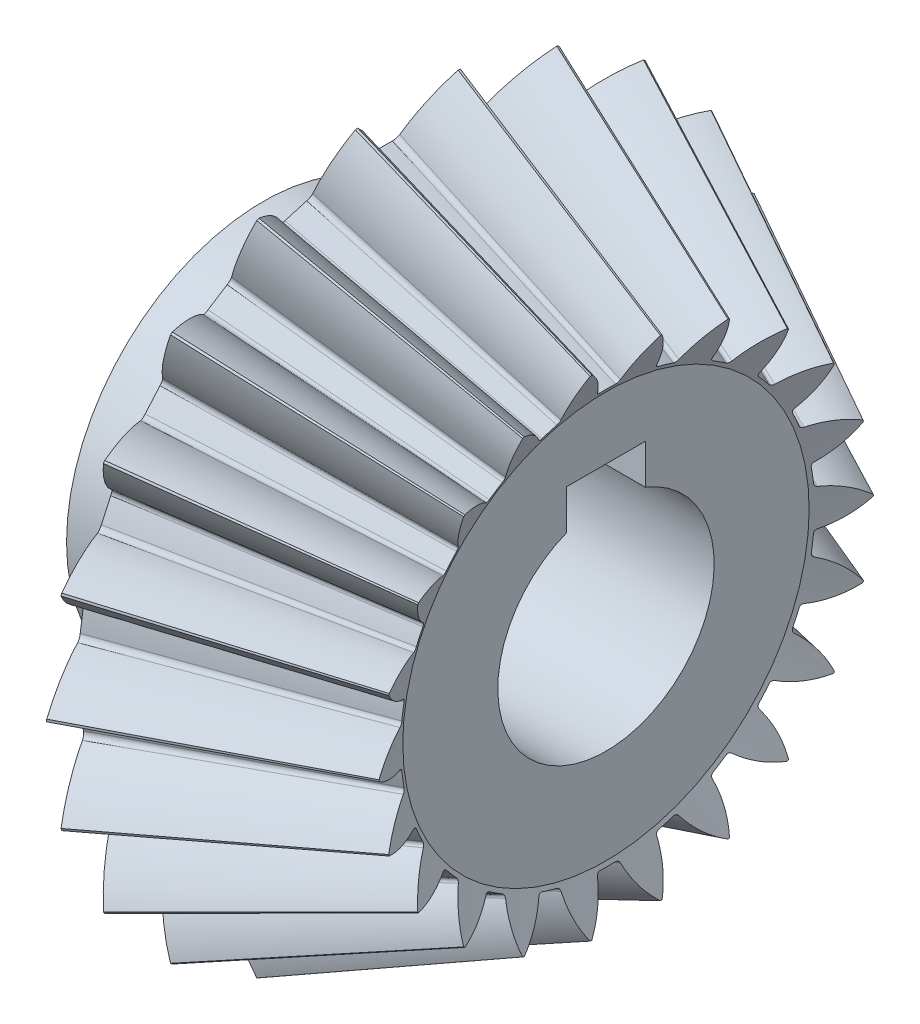
from build123d import *

# Parameters (mm, degrees)
TEETHCUTS_COUNT = 22
TEETHCUTS_ANGLE = 343.636363636
HUBSKE_R        = 20
HUB_DEPTH       = 11.711130341
BORSKE_R        = 11
BORE_DEPTH      = 85.0000508
KEYSKE_W        = 8
KEYSKE_H        = 14.3
KEYWAY_DEPTH    = 85.0000508


with BuildPart() as part:
    # BasProSke → Base-Revolve (revolve)
    with BuildSketch(Plane(origin=(0, 0, 0), x_dir=(1, 0, 0), z_dir=(0, 1, 0)), mode=Mode.PRIVATE) as base_revolve_sk:
        Polygon((0, 0), (0, 30.187699073), (2.993132429, 36.718169819), (25.18183877, 25.128171007), (23.133481134, 20.659027079), (23.133481134, 0), align=None)
    revolve(base_revolve_sk.sketch.rotate(Axis((-10, 0, 0), (1, 0, 0)), 180), axis=Axis((-10, 0, 0), (1, 0, 0)))

    # ToothCut: read off the stored shape, not the designer's step
    # ToothCut: loft between two sections, ruled curve by curve
    toothcut_from = [
        Edge.make_bspline([(73.292168083, 0.006974887, -0.01012031), (73.289773509, 0.001750362, -0.014477462), (73.286789189, -0.004760882, -0.013633686), (73.28488204, -0.008921935, -0.008060281)], [0, 0, 0, 0, 1, 1, 1, 1], 3, [1, 0.813813859, 0.813813859, 1]),
        Edge.make_bspline([(73.28488204, -0.008921935, 0.008060281), (73.286789189, -0.004760882, 0.013633686), (73.289773509, 0.001750362, 0.014477462), (73.292168083, 0.006974887, 0.01012031)], [0, 0, 0, 0, 1, 1, 1, 1], 3, [1, 0.813813859, 0.813813859, 1]),
        Edge.make_bspline([(73.28488204, -0.008921935, -0.008060281), (73.284593319, -0.00955187, -0.007216531), (73.284352068, -0.010078236, -0.00629088), (73.284162271, -0.01049234, -0.005298616)], [0, 0, 0, 0, 1, 1, 1, 1], 3, [1, 0.994494893, 0.994494893, 1]),
        Edge.make_bspline([(73.284162271, -0.01049234, 0.005298616), (73.284352068, -0.010078236, 0.00629088), (73.284593319, -0.00955187, 0.007216531), (73.28488204, -0.008921935, 0.008060281)], [0, 0, 0, 0, 1, 1, 1, 1], 3, [1, 0.994494893, 0.994494893, 1]),
        Edge.make_bspline([(73.284162271, -0.01049234, -0.005298616), (73.28350847, -0.011918814, -0.001880531), (73.28350847, -0.011918814, 0.001880531), (73.284162271, -0.01049234, 0.005298616)], [0, 0, 0, 0, 1, 1, 1, 1], 3, [1, 0.939205559, 0.939205559, 1]),
        Edge.make_line((73.292168083, 0.006974887, 0.01012031), (73.292168083, 0.006974887, -0.01012031)),
    ]
    toothcut_to = [
        Edge.make_bspline([(3.117403564, 36.989306839, -5.776106756), (2.39998287, 35.424025328, -3.800644098), (1.475121547, 33.406146079, -2.407788672), (0.42191645, 31.108244054, -1.716661566)], [0, 0, 0, 0, 1, 1, 1, 1], 3, [1, 0.971492354, 0.971492354, 1]),
        Edge.make_bspline([(0.42191645, 31.108244054, 1.716661566), (1.475121547, 33.406146079, 2.407788672), (2.39998287, 35.424025328, 3.800644098), (3.117403564, 36.989306839, 5.776106756)], [0, 0, 0, 0, 1, 1, 1, 1], 3, [1, 0.971492354, 0.971492354, 1]),
        Edge.make_bspline([(0.42191645, 31.108244054, -1.716661566), (0.311926411, 30.868265787, -1.644484649), (0.244462174, 30.721071088, -1.423851058), (0.248759413, 30.730446882, -1.150372516)], [0, 0, 0, 0, 1, 1, 1, 1], 3, [1, 0.855549764, 0.855549764, 1]),
        Edge.make_bspline([(0.248759413, 30.730446882, 1.150372516), (0.244462174, 30.721071088, 1.423851058), (0.311926411, 30.868265787, 1.644484649), (0.42191645, 31.108244054, 1.716661566)], [0, 0, 0, 0, 1, 1, 1, 1], 3, [1, 0.855549764, 0.855549764, 1]),
        Edge.make_bspline([(0.248759413, 30.730446882, -1.150372516), (0.260807292, 30.756733163, -0.38363919), (0.260807292, 30.756733163, 0.38363919), (0.248759413, 30.730446882, 1.150372516)], [0, 0, 0, 0, 1, 1, 1, 1], 3, [1, 0.999526417, 0.999526417, 1]),
        Edge.make_line((3.117403564, 36.989306839, 5.776106756), (3.117403564, 36.989306839, -5.776106756)),
    ]
    toothcut = Solid(Shell([*[Face.make_surface_from_curves(toothcut_from[k], toothcut_to[k]) for k in range(6)], Face(Wire(toothcut_from)), Face(Wire(toothcut_to))]))
    add(toothcut, mode=Mode.SUBTRACT)

    # TeethCuts: ToothCut ×22 about axis
    teethcuts_axis = Axis((-10, 0, 0), (1, 0, 0))
    for i in range(1, TEETHCUTS_COUNT):
        add(toothcut.rotate(teethcuts_axis, i * TEETHCUTS_ANGLE / (TEETHCUTS_COUNT - 1)), mode=Mode.SUBTRACT)

    # HubSke → Hub (add)
    with BuildSketch(Plane.ZY):
        with Locations(Location((0, 0, 0), (0, 0, 180))):
            Circle(HUBSKE_R)
    extrude(amount=HUB_DEPTH)

    # BorSke → Bore (cut, symmetric)
    with BuildSketch(Plane(origin=(0, 0, 0), x_dir=(0, 0, -1), z_dir=(1, 0, 0))):
        with Locations(Location((0, 0, 0), (0, 0, 180))):
            Circle(BORSKE_R)
    extrude(amount=BORE_DEPTH, both=True, mode=Mode.SUBTRACT)

    # KeySke → Keyway (cut, symmetric)
    with BuildSketch(Plane(origin=(0, 0, 0), x_dir=(0, 0, -1), z_dir=(1, 0, 0))):
        with Locations((0, 7.15)):
            Rectangle(KEYSKE_W, KEYSKE_H)
    extrude(amount=KEYWAY_DEPTH, both=True, mode=Mode.SUBTRACT)


solid = part.part
